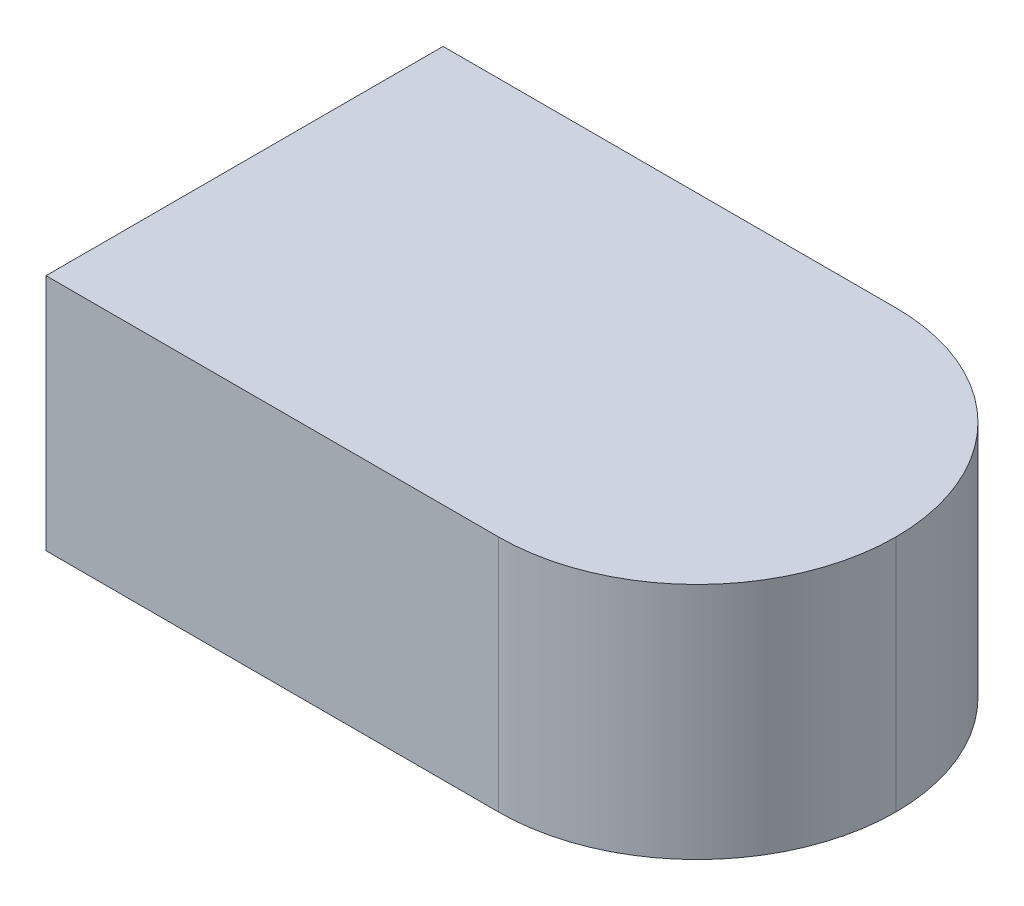
from build123d import *

# Parameters (mm, degrees)
SKETCH1_W           = 0.41
SKETCH1_H           = 0.25
BOSS_EXTRUDE1_DEPTH = 0.15
FILLET1_R           = 0.125


with BuildPart() as part:
    # Sketch1 → Boss-Extrude1 (new body)
    with BuildSketch(Plane(origin=(0, 0, 0), x_dir=(1, 0, 0), z_dir=(0, 1, 0))):
        Rectangle(SKETCH1_W, SKETCH1_H)
    extrude(amount=BOSS_EXTRUDE1_DEPTH)

    # Fillet1
    # the kernel refuses this fillet: 0.125 mm, written as the material it takes off along each edge
    with BuildSketch(Plane(origin=(0.205, -0.3125, -0.125), x_dir=(0, 0, 1), z_dir=(0, 1, 0)), Plane(origin=(0.205, -0.3125, 0.125), x_dir=(-1, 0, 0), z_dir=(0, 1, 0))) as fillet1_piece_1:
        with BuildLine():
            CenterArc((FILLET1_R, -FILLET1_R), FILLET1_R, 90, 90)
            Line((0, -FILLET1_R), (0, 0))
            Line((0, 0), (FILLET1_R, 0))
        make_face()
    extrude(amount=0.775, mode=Mode.SUBTRACT)


solid = part.part
